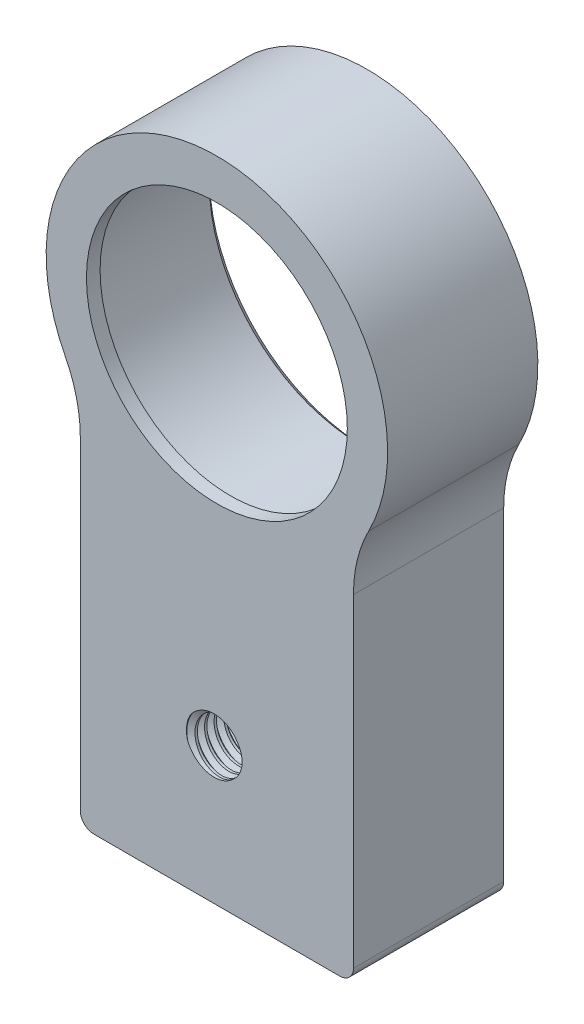
from build123d import *

# Parameters (mm, degrees)
ESQUISSE1_R             = 1.85
BOSS_EXTRU_1_DEPTH      = 11
ESQUISSE2_R             = 11.05
ENL_V_MAT_EXTRU_1_DEPTH = 10
ESQUISSE3_R             = 9.55
ENL_V_MAT_EXTRU_2_DEPTH = 51.124844139
ENL_V_MAT_EXTRU_3_DEPTH = 3
CHANFREIN1_SIZE         = 0.5
CONG_1_R                = 10
CONG_2_R                = 1
FILETAGE1_PITCH         = 0.7


with BuildPart() as part:
    # Esquisse1 → Boss.-Extru.1 (new body)
    with BuildSketch(Plane.XY):
        with BuildLine():
            Line((-10, 20), (-10, 27.5))
            ThreePointArc((-10, 27.5), (0, 47.5), (10, 27.5))
            Line((10, 27.5), (10, 20))
            Line((10, 20), (10, 0))
            Line((10, 0), (-10, 0))
            Line((-10, 0), (-10, 20))
        make_face()
        with Locations((0, 10)):
            Circle(ESQUISSE1_R, mode=Mode.SUBTRACT)
    extrude(amount=BOSS_EXTRU_1_DEPTH)

    # Esquisse2 → Enlèv. mat.-Extru.1 (cut)
    with BuildSketch(Plane(origin=(0, 0, 0), x_dir=(-1, 0, 0), z_dir=(0, 0, -1))):
        with Locations((0, 35)):
            Circle(ESQUISSE2_R)
    extrude(amount=-ENL_V_MAT_EXTRU_1_DEPTH, mode=Mode.SUBTRACT)

    # Esquisse3 → Enlèv. mat.-Extru.2 (cut, through all)
    with BuildSketch(Plane(origin=(0, 0, 10), x_dir=(-1, 0, 0), z_dir=(0, 0, -1))):
        with Locations((0, 35)):
            Circle(ESQUISSE3_R)
    extrude(amount=-ENL_V_MAT_EXTRU_2_DEPTH, mode=Mode.SUBTRACT)

    # Esquisse4 → Enlèv. mat.-Extru.3 (cut)
    with BuildSketch(Plane(origin=(0, 0, 0), x_dir=(-1, 0, 0), z_dir=(0, 0, -1))):
        with BuildLine():
            Line((-7.75, 13), (-7.75, 0))
            Line((-7.75, 0), (7.75, 0))
            Line((7.75, 0), (7.75, 13))
            ThreePointArc((7.75, 13), (0, 20.75), (-7.75, 13))
        make_face()
    extrude(amount=-ENL_V_MAT_EXTRU_3_DEPTH, mode=Mode.SUBTRACT)

    # Chanfrein1
    chanfrein1_edges = [part.edges().sort_by_distance(p)[0] for p in [
        (11.05, 35, 0),
        (-7.75, 0, 1.5),
        (7.75, 0, 1.5),
        (-1.85, 10, 3),
    ]]
    chamfer(chanfrein1_edges, length=CHANFREIN1_SIZE)

    # Congé1
    cong_1_edges = [part.edges().sort_by_distance(p)[0] for p in [
        (-10, 27.5, 5.5),
        (10, 27.5, 5.5),
    ]]
    fillet(cong_1_edges, radius=CONG_1_R)

    # Congé2
    cong_2_edges = [part.edges().sort_by_distance(p)[0] for p in [
        (10, 0, 5.5),
        (-10, 0, 5.5),
    ]]
    fillet(cong_2_edges, radius=CONG_2_R)

    # Filetage1: the profile of Profil de filetage1 profile screwed along a right-hand helix of 12.857143 turns, 6 arcs to a turn; built about Z, then put on its axis
    filetage1_z = Axis((0, 0, 0), (0, 0, 1))
    filetage1_corners = [(1.8497, 0, -0.000173205), (2.228886113, 0, 0.218749999), (2.228886113, 0, 0.306249999), (1.8497, 0, 0.525173203)]
    with BuildLine(mode=Mode.PRIVATE) as filetage1_profile:
        Line(filetage1_corners[0], filetage1_corners[1])
        Line(filetage1_corners[1], filetage1_corners[2])
        Line(filetage1_corners[2], filetage1_corners[3])
        Line(filetage1_corners[3], filetage1_corners[0])
    filetage1_cap = Face(filetage1_profile.wire())
    filetage1_turn_angles = [0, 30, 60, 90, 120, 150, 180, 210, 240, 270, 300, 330, 360]
    filetage1_turn_weights = [1, 0.8660254037844387, 1, 0.8660254037844387, 1, 0.8660254037844387, 1, 0.8660254037844387, 1, 0.8660254037844387, 1, 0.8660254037844387, 1]
    filetage1_turn_rails = [Edge.make_bspline([Vector(p[0], p[1], 0).rotate(filetage1_z, filetage1_turn_angles[k]) / filetage1_turn_weights[k] + Vector(0, 0, p[2] + FILETAGE1_PITCH * filetage1_turn_angles[k] / 360) for k in range(13)], [0, 0, 0, 1, 1, 2, 2, 3, 3, 4, 4, 5, 5, 6, 6, 6], 2, filetage1_turn_weights) for p in filetage1_corners]
    filetage1_turn_sides = [Face.make_surface_from_curves(filetage1_turn_rails[p[0]], filetage1_turn_rails[p[1]]) for p in [(0, 1), (1, 2), (2, 3), (3, 0)]]
    filetage1_last_angles = [4320, 4350, 4380, 4410, 4440, 4470, 4500, 4530, 4560, 4590, 4620, 4624.285714286, 4628.571428571]
    filetage1_last_weights = [1, 0.8660254037844387, 1, 0.8660254037844387, 1, 0.8660254037844387, 1, 0.8660254037844387, 1, 0.8660254037844387, 1, 0.9972037971811797, 1]
    filetage1_last_rails = [Edge.make_bspline([Vector(p[0], p[1], 0).rotate(filetage1_z, filetage1_last_angles[k]) / filetage1_last_weights[k] + Vector(0, 0, p[2] + FILETAGE1_PITCH * filetage1_last_angles[k] / 360) for k in range(13)], [0, 0, 0, 1, 1, 2, 2, 3, 3, 4, 4, 5, 5, 6, 6, 6], 2, filetage1_last_weights) for p in filetage1_corners]
    filetage1_last_sides = [Face.make_surface_from_curves(filetage1_last_rails[p[0]], filetage1_last_rails[p[1]]) for p in [(0, 1), (1, 2), (2, 3), (3, 0)]]
    filetage1 = Plane(origin=(0, 10, 2), x_dir=(1, 0, 0), z_dir=(0, 0, 1)) * Solid(Shell([*[p.moved(Location((0, 0, FILETAGE1_PITCH * i))) for i in range(12) for p in filetage1_turn_sides], *filetage1_last_sides, filetage1_cap, filetage1_cap.rotate(filetage1_z, 4628.571428571).moved(Location((0, 0, FILETAGE1_PITCH * 4628.571428571 / 360)))]))
    add(filetage1, mode=Mode.SUBTRACT)


solid = part.part
